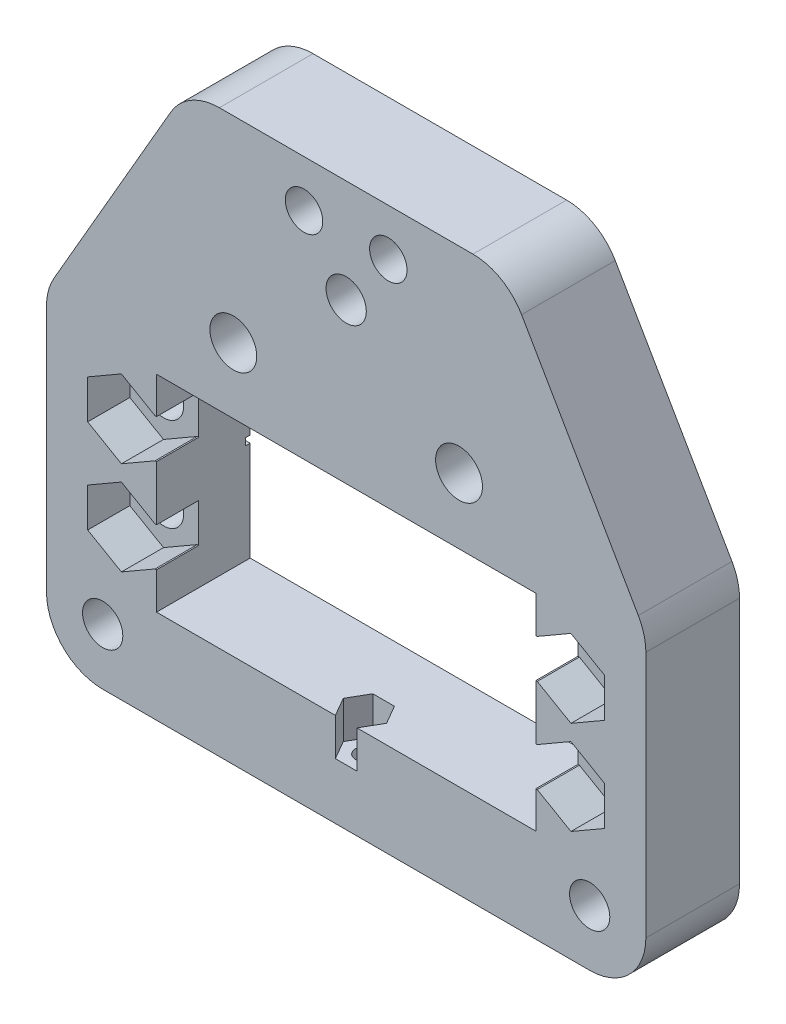
from build123d import *

# Parameters (mm, degrees)
EXTRUDE_1_DEPTH         = 10
FILLET_1_R              = 6
SKETCH_2_W              = 40.5
SKETCH_2_H              = 22
CUT_EXTRUDE_1_DEPTH     = 89.294960219
HOLE_WIZARD_4_0_1_D     = 4
HOLE_WIZARD_5_0_1_D     = 5
HOLE_WIZARD_M41_D       = 4.3
CUT_EXTRUDE_4_DEPTH     = 4.5
HOLE_WIZARD_M42_D       = 4.3
CUT_EXTRUDE_7_DEPTH     = 3.2
SKETCH_19_W             = 4.5
SKETCH_19_H             = 4.156921938
CUT_EXTRUDE_13_DEPTH    = 0.15
SKETCH_21_W             = 4.5
SKETCH_21_H             = 4.156921938
CUT_EXTRUDE_14_DEPTH    = 0.15
SKETCH_22_W             = 4.5
SKETCH_22_H             = 4.156921938
CUT_EXTRUDE_15_DEPTH    = 0.15
SKETCH_23_W             = 4.5
SKETCH_23_H             = 4.156921938
CUT_EXTRUDE_16_DEPTH    = 0.15
CUT_EXTRUDE_17_DEPTH    = 4
HOLE_WIZARD_M2_21_D     = 2
HOLE_WIZARD_M2_21_DEPTH = 10
HOLE_WIZARD_M2_21_TIP   = 0.600860619
CUT_EXTRUDE_19_DEPTH    = 0.375
CUT_EXTRUDE_20_DEPTH    = 0.375


with BuildPart() as part:
    # Эскиз1 → Бобышка-Вытянуть1 (new body)
    with BuildSketch(Plane.XY):
        Polygon((0, 0), (64, 0), (64, 34.019237886), (49, 60), (15, 60), (0, 34.02), align=None)
    extrude(amount=EXTRUDE_1_DEPTH)

    # Скругление1
    fillet_1_edges = [part.edges().sort_by_distance(p)[0] for p in [
        (49, 60, 5),
        (15, 60, 5),
        (0, 34.02, 5),
        (0, 0, 5),
        (64, 34.019237886, 5),
        (64, 0, 5),
    ]]
    fillet(fillet_1_edges, radius=FILLET_1_R)

    # Эскиз2 → Вырез-Вытянуть1 (cut, through all)
    with BuildSketch(Plane.XY.offset(10)):
        with Locations((32, 21)):
            Rectangle(SKETCH_2_W, SKETCH_2_H)
    extrude(amount=-CUT_EXTRUDE_1_DEPTH, mode=Mode.SUBTRACT)

    # Отверстия под штифты Ø4.0 мм1 (through all)
    with Locations(Plane.XY.offset(10)):
        with Locations((27.499949191, 55), (36.5, 55)):
            Hole(HOLE_WIZARD_4_0_1_D / 2)

    # Отверстия под штифты Ø5.0 мм1 (through all)
    with Locations(Plane.XY.offset(10)):
        with Locations((19.949949191, 39), (44.05, 39)):
            Hole(HOLE_WIZARD_5_0_1_D / 2)

    # Сверло под метчик  спиральное M41 (through all)
    with Locations(Plane.XY.offset(10)):
        with Locations((56, 26), (56, 16), (8, 26), (8, 16)):
            Hole(HOLE_WIZARD_M41_D / 2)

    # Эскиз9 → Вырез-Вытянуть4 (cut)
    with BuildSketch(Plane(origin=(0, 0, 10), x_dir=(-1, 0, 0), z_dir=(0, 0, -1))):
        Polygon((-56, 30.156921938), (-59.6, 28.078460969), (-59.6, 23.921539031), (-56, 21.843078062), (-52.4, 23.921539031), (-52.4, 28.078460969), align=None)
        Polygon((-56, 20.156921938), (-59.6, 18.078460969), (-59.6, 13.921539031), (-56, 11.843078062), (-52.4, 13.921539031), (-52.4, 18.078460969), align=None)
        Polygon((-8, 30.156921938), (-11.6, 28.078460969), (-11.6, 23.921539031), (-8, 21.843078062), (-4.4, 23.921539031), (-4.4, 28.078460969), align=None)
        Polygon((-8, 20.156921938), (-11.6, 18.078460969), (-11.6, 13.921539031), (-8, 11.843078062), (-4.4, 13.921539031), (-4.4, 18.078460969), align=None)
    extrude(amount=CUT_EXTRUDE_4_DEPTH, mode=Mode.SUBTRACT)

    # Сверло под метчик  спиральное M42 (through all)
    with Locations(Plane.XY.offset(10)):
        with Locations((32, 49), (6, 6), (58, 6)):
            Hole(HOLE_WIZARD_M42_D / 2)

    # Эскиз18 → Вырез-Вытянуть7 (cut)
    with BuildSketch(Plane(origin=(0, 0, 0), x_dir=(-1, 0, 0), z_dir=(0, 0, -1))):
        Polygon((-32, 53.156921938), (-35.6, 51.078460969), (-35.6, 46.921539031), (-32, 44.843078062), (-28.4, 46.921539031), (-28.4, 51.078460969), align=None)
        Polygon((-58, 10.156921938), (-61.6, 8.078460969), (-61.6, 3.921539031), (-58, 1.843078062), (-54.4, 3.921539031), (-54.4, 8.078460969), align=None)
        Polygon((-6, 10.156921938), (-9.6, 8.078460969), (-9.6, 3.921539031), (-6, 1.843078062), (-2.4, 3.921539031), (-2.4, 8.078460969), align=None)
    extrude(amount=-CUT_EXTRUDE_7_DEPTH, mode=Mode.SUBTRACT)

    # Эскиз19 → Вырез-Вытянуть13 (cut)
    with BuildSketch(Plane.ZY.offset(-52.25)):
        with Locations((7.75, 26)):
            Rectangle(SKETCH_19_W, SKETCH_19_H)
    extrude(amount=-CUT_EXTRUDE_13_DEPTH, mode=Mode.SUBTRACT)

    # Эскиз21 → Вырез-Вытянуть14 (cut)
    with BuildSketch(Plane(origin=(11.75, 0, 0), x_dir=(0, 0, -1), z_dir=(1, 0, 0))):
        with Locations((-7.75, 26)):
            Rectangle(SKETCH_21_W, SKETCH_21_H)
    extrude(amount=-CUT_EXTRUDE_14_DEPTH, mode=Mode.SUBTRACT)

    # Эскиз22 → Вырез-Вытянуть15 (cut)
    with BuildSketch(Plane.ZY.offset(-52.25)):
        with Locations((7.75, 16)):
            Rectangle(SKETCH_22_W, SKETCH_22_H)
    extrude(amount=-CUT_EXTRUDE_15_DEPTH, mode=Mode.SUBTRACT)

    # Эскиз23 → Вырез-Вытянуть16 (cut)
    with BuildSketch(Plane(origin=(11.75, 0, 0), x_dir=(0, 0, -1), z_dir=(1, 0, 0))):
        with Locations((-7.75, 16)):
            Rectangle(SKETCH_23_W, SKETCH_23_H)
    extrude(amount=-CUT_EXTRUDE_16_DEPTH, mode=Mode.SUBTRACT)

    # Эскиз12 → Вырез-Вытянуть17 (cut)
    with BuildSketch(Plane(origin=(0, 10, 0), x_dir=(1, 0, 0), z_dir=(0, 1, 0))):
        Polygon((34.309375673, -8), (33.154675134, -6), (30.845274057, -6), (29.690573519, -8), (30.845274057, -10), (33.154675134, -10), align=None)
    extrude(amount=-CUT_EXTRUDE_17_DEPTH, mode=Mode.SUBTRACT)

    # Сверло под метчик  спиральное M2.21
    with Locations(Plane(origin=(0, 0, 0), x_dir=(-1, 0, 0), z_dir=(0, -1, 0))):
        with Locations((-32, -8)):
            Hole(HOLE_WIZARD_M2_21_D / 2, depth=HOLE_WIZARD_M2_21_DEPTH)
            with Locations((0, 0, -(HOLE_WIZARD_M2_21_DEPTH + HOLE_WIZARD_M2_21_TIP / 2))):  # 118° drill point
                Cone(0, HOLE_WIZARD_M2_21_D / 2, HOLE_WIZARD_M2_21_TIP, mode=Mode.SUBTRACT)

    # Эскиз29 → Вырез-Вытянуть19 (cut, symmetric)
    with BuildSketch(Plane(origin=(0, 21, 0), x_dir=(1, 0, 0), z_dir=(0, 1, 0))):
        Polygon((5.75, 0), (12.75, 0), (12.75, -0.612420645), align=None)
    extrude(amount=CUT_EXTRUDE_19_DEPTH, both=True, mode=Mode.SUBTRACT)

    # Эскиз29<3> → Вырез-Вытянуть20 (cut, symmetric)
    with BuildSketch(Plane(origin=(0, 21, 0), x_dir=(1, 0, 0), z_dir=(0, 1, 0))):
        Polygon((51.25, 0), (51.25, -0.612420645), (58.25, 0), align=None)
    extrude(amount=CUT_EXTRUDE_20_DEPTH, both=True, mode=Mode.SUBTRACT)


solid = part.part
